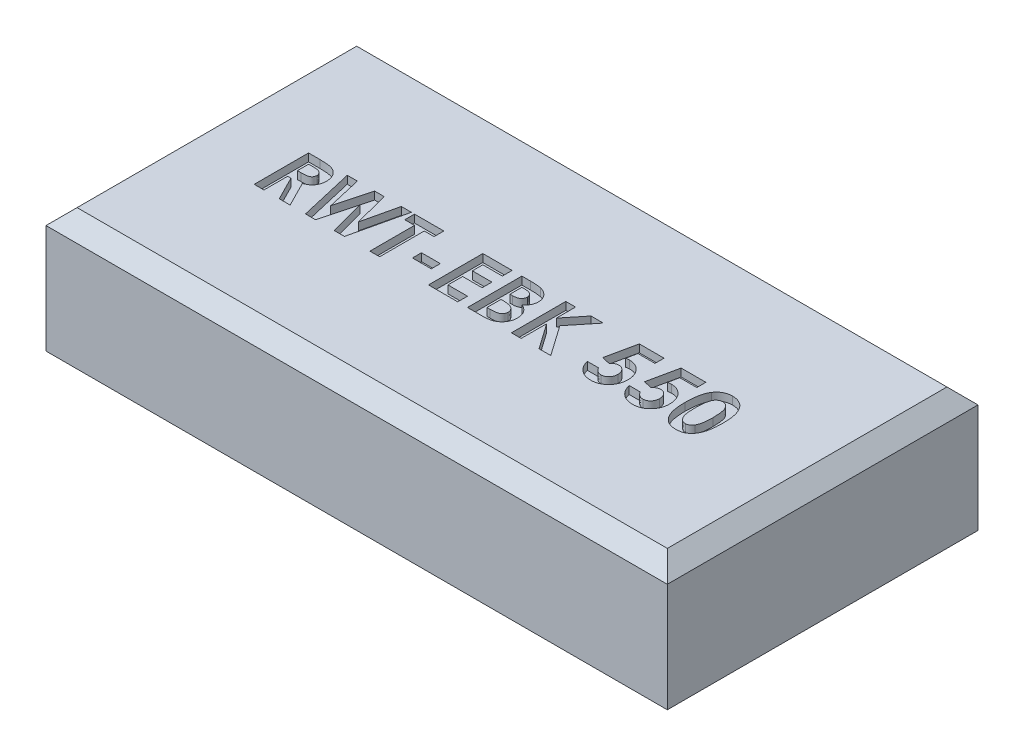
from build123d import *

# Parameters (mm, degrees)
SKETCH1_W           = 40
SKETCH1_H           = 20
BOSS_EXTRUDE1_DEPTH = 8
CHAMFER1_SIZE       = 1
SKETCH4_W           = 1.211538461
SKETCH4_H           = 0.583333333
CUT_EXTRUDE3_DEPTH  = 0.5


with BuildPart() as part:
    # Sketch1 → Boss-Extrude1 (new body)
    with BuildSketch(Plane(origin=(0, 0, 0), x_dir=(1, 0, 0), z_dir=(0, 1, 0))):
        with Locations((0, 2.318501171)):
            Rectangle(SKETCH1_W, SKETCH1_H)
    extrude(amount=BOSS_EXTRUDE1_DEPTH)

    # Chamfer1
    chamfer1_edges = [part.edges().sort_by_distance(p)[0] for p in [
        (0, 8, 7.681498829),
        (-20, 8, -2.318501171),
        (0, 8, -12.318501171),
        (20, 8, -2.318501171),
    ]]
    chamfer(chamfer1_edges, length=CHAMFER1_SIZE)

    # Sketch4 → Cut-Extrude3 (cut)
    # profile 1 of 10: a face of its own
    with BuildSketch(Plane(origin=(0, 8, 0), x_dir=(1, 0, 0), z_dir=(0, 1, 0))):
        with BuildLine():
            Line((-14.596153846, 3.818501171), (-13.864182692, 3.818501171))
            add(Edge.make_bspline(
                [(-13.864182692, 3.818501171), (-13.815799622, 3.818329439), (-13.722745349, 3.81799915), (-13.588566169, 3.81278806), (-13.46530414, 3.805536401), (-13.352776761, 3.794470177), (-13.251032173, 3.779797701), (-13.159968404, 3.76250128), (-13.079588115, 3.742788301), (-13.009213411, 3.718224373), (-12.945703721, 3.690516634), (-12.886503859, 3.658679935), (-12.830307791, 3.623068786), (-12.777491125, 3.582746162), (-12.727594872, 3.538437457), (-12.6805249, 3.49009807), (-12.636946351, 3.437318103), (-12.597129066, 3.380431058), (-12.560838815, 3.320587191), (-12.528765845, 3.257704336), (-12.502684052, 3.191738763), (-12.479637993, 3.123643816), (-12.463038663, 3.052446065), (-12.451494071, 2.978838632), (-12.443041573, 2.902562411), (-12.442555595, 2.850743733), (-12.442307692, 2.824310466)],
                knots=[0, 0, 0, 0, 1.749336639, 3.364467119, 4.854658419, 6.213483162, 7.451590619, 8.570285859, 9.5643256, 10.440900261, 11.26203566, 12.067320669, 12.869050712, 13.665104639, 14.467235401, 15.27997916, 16.102287765, 16.939272006, 17.78853747, 18.631303466, 19.488103222, 20.351255419, 21.228522269, 22.127379805, 23.044756219, 24, 24, 24, 24], degree=3))
            add(Edge.make_bspline(
                [(-12.442307692, 2.824310466), (-12.442951654, 2.796720207), (-12.444214347, 2.742620739), (-12.451015895, 2.663153032), (-12.46344699, 2.587123888), (-12.48227569, 2.514755912), (-12.503916836, 2.4451484), (-12.532694008, 2.379585653), (-12.565171892, 2.317114157), (-12.603744925, 2.258617595), (-12.646076944, 2.20279664), (-12.695308193, 2.151790002), (-12.748249241, 2.102856265), (-12.807876098, 2.059060474), (-12.871560358, 2.017441316), (-12.940567358, 1.979723274), (-13.014446736, 1.944958206), (-13.066387598, 1.925570802), (-13.092948718, 1.91565662)],
                knots=[0, 0, 0, 0, 1.099860209, 2.156625411, 3.176576793, 4.16617041, 5.135385252, 6.078461593, 7.016046972, 7.938469504, 8.868247731, 9.803980173, 10.76021508, 11.73834243, 12.748633912, 13.790971185, 14.870363756, 16, 16, 16, 16], degree=3))
            Line((-13.092948718, 1.91565662), (-12.28525641, 0.318501171))
            Line((-12.28525641, 0.318501171), (-12.983573718, 0.318501171))
            Line((-12.983573718, 0.318501171), (-13.754807692, 1.844142197))
            Line((-13.754807692, 1.844142197), (-13.967948718, 1.844142197))
            Line((-13.967948718, 1.844142197), (-13.967948718, 0.318501171))
            Line((-13.967948718, 0.318501171), (-14.596153846, 0.318501171))
            Line((-14.596153846, 0.318501171), (-14.596153846, 3.818501171))
        make_face()
        with BuildLine():
            Line((-13.967948718, 2.472347325), (-13.723257212, 2.472347325))
            add(Edge.make_bspline(
                [(-13.723257212, 2.472347325), (-13.693341641, 2.472684254), (-13.636059751, 2.473329401), (-13.55368087, 2.476321861), (-13.4788612, 2.483532211), (-13.41127944, 2.492642218), (-13.350595524, 2.503161037), (-13.297350732, 2.518235143), (-13.250724642, 2.534387429), (-13.211269776, 2.554460531), (-13.177560445, 2.577288002), (-13.148454596, 2.603220576), (-13.124379885, 2.633234229), (-13.104565169, 2.666513318), (-13.089151475, 2.70335219), (-13.07790066, 2.743346436), (-13.071613117, 2.786951643), (-13.070889714, 2.817045173), (-13.070512821, 2.832723927)],
                knots=[0, 0, 0, 0, 1.688639943, 3.233382647, 4.650958383, 5.928841754, 7.082724185, 8.122798841, 9.049171256, 9.863274652, 10.613301712, 11.341792392, 12.054588806, 12.776240173, 13.521029143, 14.301969904, 15.115324896, 16, 16, 16, 16], degree=3))
            add(Edge.make_bspline(
                [(-13.070512821, 2.832723927), (-13.071225372, 2.851273039), (-13.072625049, 2.88770933), (-13.086514186, 2.940164814), (-13.108622693, 2.988715953), (-13.1389274, 3.033143381), (-13.177092239, 3.072091531), (-13.220889403, 3.106424636), (-13.27126414, 3.133572687), (-13.317907356, 3.151479252), (-13.36034178, 3.162192934), (-13.398637509, 3.170176676), (-13.442984193, 3.175834983), (-13.493415313, 3.181836624), (-13.549802317, 3.185728385), (-13.612452548, 3.188568594), (-13.681186076, 3.189730664), (-13.729099873, 3.190102157), (-13.754106571, 3.190296043)],
                knots=[0, 0, 0, 0, 1.020303359, 2.004196876, 2.966617323, 3.9489082, 4.950758222, 5.960522915, 7.003732012, 8.091992268, 8.70421221, 9.413913587, 10.24622431, 11.166358409, 12.212345909, 13.359657661, 14.621978493, 16, 16, 16, 16], degree=3))
            Line((-13.754106571, 3.190296043), (-13.967948718, 3.190296043))
            Line((-13.967948718, 3.190296043), (-13.967948718, 2.472347325))
        make_face(mode=Mode.SUBTRACT)
    # profile 2 of 10: a face of its own
    with BuildSketch(Plane(origin=(0, 8, 0), x_dir=(1, 0, 0), z_dir=(0, 1, 0))):
        Polygon((-12.105769231, 3.818501171), (-11.457231571, 3.818501171), (-10.939102564, 1.584026011), (-10.345252404, 3.818501171), (-9.734575321, 3.818501171), (-9.144230769, 1.584026011), (-8.627504006, 3.818501171), (-7.977564103, 3.818501171), (-8.787359776, 0.318501171), (-9.443609776, 0.318501171), (-10.041666667, 2.581021203), (-10.643229167, 0.318501171), (-11.294571314, 0.318501171), align=None)
    # profile 3 of 10: a face of its own
    with BuildSketch(Plane(origin=(0, 8, 0), x_dir=(1, 0, 0), z_dir=(0, 1, 0))):
        Polygon((-7.775641026, 3.818501171), (-5.891025641, 3.818501171), (-5.891025641, 3.190296043), (-6.519230769, 3.190296043), (-6.519230769, 0.318501171), (-7.147435897, 0.318501171), (-7.147435897, 3.190296043), (-7.775641026, 3.190296043), align=None)
    # profile 4 of 10: a face of its own
    with BuildSketch(Plane(origin=(0, 8, 0), x_dir=(1, 0, 0), z_dir=(0, 1, 0))):
        with Locations((-4.791666667, 1.597347325)):
            Rectangle(SKETCH4_W, SKETCH4_H)
    # profile 5 of 10: a face of its own
    with BuildSketch(Plane(origin=(0, 8, 0), x_dir=(1, 0, 0), z_dir=(0, 1, 0))):
        Polygon((-3.378205128, 3.818501171), (-1.493589744, 3.818501171), (-1.493589744, 3.190296043), (-2.75, 3.190296043), (-2.75, 2.51721912), (-1.493589744, 2.51721912), (-1.493589744, 1.889013991), (-2.75, 1.889013991), (-2.75, 0.946706299), (-1.493589744, 0.946706299), (-1.493589744, 0.318501171), (-3.378205128, 0.318501171), align=None)
    # profile 6 of 10: a face of its own
    with BuildSketch(Plane(origin=(0, 8, 0), x_dir=(1, 0, 0), z_dir=(0, 1, 0))):
        with BuildLine():
            Line((-0.865384615, 0.318501171), (-0.865384615, 3.818501171))
            Line((-0.865384615, 3.818501171), (-0.304487179, 3.818501171))
            add(Edge.make_bspline(
                [(-0.304487179, 3.818501171), (-0.265220852, 3.818505652), (-0.189241252, 3.818514323), (-0.079622519, 3.814664873), (0.022039599, 3.809685178), (0.115421572, 3.804114058), (0.200682344, 3.794513904), (0.277692262, 3.784396391), (0.346605192, 3.772195293), (0.389210312, 3.76125053), (0.409254808, 3.756101331)],
                knots=[0, 0, 0, 0, 1.311965854, 2.538629056, 3.664479157, 4.713267157, 5.663616078, 6.530575999, 7.308677837, 8, 8, 8, 8], degree=3))
            add(Edge.make_bspline(
                [(0.409254808, 3.756101331), (0.435575266, 3.748838294), (0.487224455, 3.734585883), (0.561202576, 3.705802524), (0.631381143, 3.673807779), (0.697674471, 3.637307759), (0.759675491, 3.595861807), (0.817148578, 3.549140995), (0.871333285, 3.499020694), (0.920305637, 3.444104065), (0.964568575, 3.386074475), (1.003025131, 3.324947127), (1.03643895, 3.2616567), (1.063178757, 3.195406725), (1.083326699, 3.126502301), (1.09806282, 3.055237661), (1.107613822, 2.981387306), (1.108516267, 2.931144495), (1.108974359, 2.905640594)],
                knots=[0, 0, 0, 0, 1.099996261, 2.158545794, 3.195537121, 4.207578794, 5.205712374, 6.197378256, 7.190519799, 8.17788031, 9.159561366, 10.129234751, 11.085776129, 12.040971148, 13.00380137, 13.975669004, 14.972423361, 16, 16, 16, 16], degree=3))
            add(Edge.make_bspline(
                [(1.108974359, 2.905640594), (1.107776583, 2.872874775), (1.105418909, 2.808379286), (1.090357925, 2.713647082), (1.062116233, 2.624111532), (1.025162666, 2.538122532), (0.974917368, 2.456000819), (0.911115557, 2.377785442), (0.834790614, 2.30106803), (0.776245169, 2.255081117), (0.745793269, 2.231161427)],
                knots=[0, 0, 0, 0, 0.986156485, 1.941127874, 2.875419072, 3.804401753, 4.751181392, 5.761612777, 6.835722519, 8, 8, 8, 8], degree=3))
            add(Edge.make_bspline(
                [(0.745793269, 2.231161427), (0.770470028, 2.218564156), (0.818854324, 2.193864392), (0.887545811, 2.153265354), (0.951146629, 2.110083128), (1.009941945, 2.065186558), (1.062698461, 2.016672412), (1.111594582, 1.967336144), (1.154218027, 1.914350989), (1.192333195, 1.85960544), (1.225462281, 1.802306775), (1.254314061, 1.742551757), (1.278684124, 1.680136252), (1.299321324, 1.615377904), (1.314712554, 1.548053973), (1.324747963, 1.478140383), (1.332431699, 1.405875574), (1.333029422, 1.35665059), (1.333333333, 1.331622165)],
                knots=[0, 0, 0, 0, 1.164658916, 2.283573913, 3.35186032, 4.395461096, 5.390182219, 6.362969632, 7.312859996, 8.245001507, 9.165155236, 10.092416118, 11.032087915, 11.979892451, 12.947605196, 13.931445124, 14.948243989, 16, 16, 16, 16], degree=3))
            add(Edge.make_bspline(
                [(1.333333333, 1.331622165), (1.331361149, 1.283819302), (1.327469051, 1.189480545), (1.29901193, 1.050969584), (1.249676325, 0.91964863), (1.18342878, 0.796039608), (1.101799059, 0.683720797), (1.007948289, 0.585330494), (0.902821331, 0.502045287), (0.805829006, 0.445834233), (0.721938284, 0.40811136), (0.652453165, 0.384788701), (0.577827621, 0.363182624), (0.49669469, 0.348010391), (0.410525202, 0.334123096), (0.318478999, 0.325548791), (0.220728113, 0.319738197), (0.153588579, 0.318921849), (0.118990385, 0.318501171)],
                knots=[0, 0, 0, 0, 1.284142165, 2.534249414, 3.780121997, 5.041676246, 6.291546858, 7.49970053, 8.684500223, 9.883330709, 10.50184324, 11.153274765, 11.851151195, 12.587658647, 13.369265475, 14.195992086, 15.070362669, 16, 16, 16, 16], degree=3))
            Line((0.118990385, 0.318501171), (-0.865384615, 0.318501171))
        make_face()
        with BuildLine():
            Line((-0.237179487, 3.190296043), (-0.237179487, 2.42747553))
            Line((-0.237179487, 2.42747553), (-0.0703125, 2.42747553))
            add(Edge.make_bspline(
                [(-0.0703125, 2.42747553), (-0.047633777, 2.427673297), (-0.003853875, 2.428055074), (0.059381549, 2.432972233), (0.118180282, 2.441361212), (0.172319311, 2.453065948), (0.222302963, 2.467929257), (0.267811927, 2.485813017), (0.308646108, 2.507633149), (0.356085982, 2.540135198), (0.406233349, 2.587963419), (0.450377513, 2.657061193), (0.476378131, 2.736523371), (0.479273899, 2.792566252), (0.480769231, 2.821505979)],
                knots=[0, 0, 0, 0, 1.065314748, 2.056525647, 2.977365736, 3.853934255, 4.656397591, 5.425096493, 6.14721249, 6.826394842, 8.123232004, 9.372140726, 10.643011755, 12, 12, 12, 12], degree=3))
            add(Edge.make_bspline(
                [(0.480769231, 2.821505979), (0.479572691, 2.848612841), (0.47725923, 2.901022871), (0.451079951, 2.97461122), (0.410418355, 3.039825558), (0.362411626, 3.084459439), (0.317203962, 3.114943064), (0.278494386, 3.135015233), (0.236007719, 3.152983634), (0.188921466, 3.166722711), (0.137504514, 3.17703203), (0.082006625, 3.184602991), (0.022332045, 3.189756109), (-0.018885315, 3.190112204), (-0.040164263, 3.190296043)],
                knots=[0, 0, 0, 0, 1.347982417, 2.606269829, 3.849316587, 5.153353503, 5.842674298, 6.568177932, 7.326619318, 8.142485038, 9.012069166, 9.942760135, 10.937925643, 12, 12, 12, 12], degree=3))
            Line((-0.040164263, 3.190296043), (-0.237179487, 3.190296043))
        make_face(mode=Mode.SUBTRACT)
        with BuildLine():
            Line((-0.237179487, 1.844142197), (-0.237179487, 0.946706299))
            Line((-0.237179487, 0.946706299), (-0.056290064, 0.946706299))
            add(Edge.make_bspline(
                [(-0.056290064, 0.946706299), (-0.020527995, 0.946910607), (0.048229046, 0.947303413), (0.146723385, 0.952049449), (0.236279363, 0.960603342), (0.316659689, 0.971282188), (0.387987483, 0.985750355), (0.450021639, 1.004144774), (0.503612874, 1.02438184), (0.548439854, 1.049377018), (0.585060929, 1.078465208), (0.618107609, 1.108194036), (0.645051813, 1.142489048), (0.666370569, 1.179878054), (0.684821916, 1.219432285), (0.695950465, 1.262696318), (0.704423352, 1.308387911), (0.704889637, 1.339991798), (0.705128205, 1.356161427)],
                knots=[0, 0, 0, 0, 1.753078804, 3.370512758, 4.83203934, 6.162291463, 7.344201807, 8.395507345, 9.331626367, 10.147333109, 10.898971645, 11.62040215, 12.321813352, 13.025280112, 13.727906689, 14.453419512, 15.208716525, 16, 16, 16, 16], degree=3))
            add(Edge.make_bspline(
                [(0.705128205, 1.356161427), (0.704602095, 1.374651653), (0.703577374, 1.410665639), (0.695208464, 1.463303922), (0.67999942, 1.512445252), (0.660842888, 1.559346239), (0.634185556, 1.602327663), (0.602504228, 1.642876951), (0.564225095, 1.679620976), (0.521177978, 1.714782156), (0.470967777, 1.745567673), (0.413570936, 1.772279563), (0.348675643, 1.79458835), (0.27608088, 1.81235062), (0.196104895, 1.827425213), (0.108163951, 1.83642641), (0.012990452, 1.843120995), (-0.053004401, 1.843794061), (-0.087139423, 1.844142197)],
                knots=[0, 0, 0, 0, 0.845221588, 1.646264278, 2.427170338, 3.19324141, 3.95557735, 4.731569926, 5.540061037, 6.376114724, 7.268642756, 8.224665384, 9.265483498, 10.400594375, 11.639216012, 12.983232105, 14.439614077, 16, 16, 16, 16], degree=3))
            Line((-0.087139423, 1.844142197), (-0.237179487, 1.844142197))
        make_face(mode=Mode.SUBTRACT)
    # profile 7 of 10: a face of its own
    with BuildSketch(Plane(origin=(0, 8, 0), x_dir=(1, 0, 0), z_dir=(0, 1, 0))):
        Polygon((1.961538462, 3.818501171), (2.58974359, 3.818501171), (2.58974359, 2.586630177), (3.582532051, 3.818501171), (4.375500801, 3.818501171), (3.128205128, 2.270424248), (4.496794872, 0.318501171), (3.740284455, 0.318501171), (2.58974359, 1.959827293), (2.58974359, 0.318501171), (1.961538462, 0.318501171), align=None)
    # profile 8 of 10: a face of its own
    with BuildSketch(Plane(origin=(0, 8, 0), x_dir=(1, 0, 0), z_dir=(0, 1, 0))):
        with BuildLine():
            Line((6.694811699, 3.818501171), (8.288461538, 3.818501171))
            Line((8.288461538, 3.818501171), (8.288461538, 3.235167838))
            Line((8.288461538, 3.235167838), (7.192608173, 3.235167838))
            Line((7.192608173, 3.235167838), (7.055889423, 2.573308863))
            add(Edge.make_bspline(
                [(7.055889423, 2.573308863), (7.07451931, 2.578497522), (7.111261274, 2.588730623), (7.166613089, 2.598993128), (7.220256712, 2.605644958), (7.255457329, 2.606532224), (7.272536058, 2.606962709)],
                knots=[0, 0, 0, 0, 1.05461699, 2.079921384, 3.068411212, 4, 4, 4, 4], degree=3))
            add(Edge.make_bspline(
                [(7.272536058, 2.606962709), (7.309752396, 2.606109919), (7.383113996, 2.60442888), (7.490432708, 2.588470341), (7.593196714, 2.563336125), (7.691091546, 2.527489548), (7.784021573, 2.480834303), (7.872099445, 2.424394534), (7.955433262, 2.358071113), (8.032542665, 2.281822516), (8.103394006, 2.19809983), (8.164995206, 2.107544887), (8.217606474, 2.011448911), (8.259451659, 1.909214572), (8.292479446, 1.801483971), (8.316346062, 1.688188071), (8.330459584, 1.569192598), (8.332362706, 1.488010495), (8.333333333, 1.446606139)],
                knots=[0, 0, 0, 0, 1.01440847, 1.999622559, 2.951875003, 3.895578053, 4.836219714, 5.782137149, 6.743708247, 7.735272588, 8.734977101, 9.730283169, 10.717124674, 11.717316708, 12.737475749, 13.78628267, 14.87096371, 16, 16, 16, 16], degree=3))
            add(Edge.make_bspline(
                [(8.333333333, 1.446606139), (8.332147212, 1.404731748), (8.329806647, 1.322101333), (8.314536605, 1.200605395), (8.287584707, 1.084239715), (8.250563578, 0.972692784), (8.201790611, 0.866784445), (8.143134442, 0.765417568), (8.073603355, 0.669344566), (7.993879688, 0.579550304), (7.907209604, 0.497476624), (7.814926423, 0.425276252), (7.717678463, 0.364520223), (7.615463378, 0.31541908), (7.508867607, 0.276571129), (7.397858799, 0.248291676), (7.281897463, 0.232074981), (7.203174783, 0.229875532), (7.163161058, 0.228757581)],
                knots=[0, 0, 0, 0, 1.06808661, 2.107647099, 3.116961351, 4.110378221, 5.100014249, 6.085620622, 7.093190682, 8.119403071, 9.144090782, 10.133780668, 11.103064255, 12.062861538, 13.020824475, 13.992378307, 14.979551724, 16, 16, 16, 16], degree=3))
            add(Edge.make_bspline(
                [(7.163161058, 0.228757581), (7.127377974, 0.229672135), (7.056806245, 0.231475826), (6.952857186, 0.242562264), (6.85263875, 0.262163189), (6.756682988, 0.290530803), (6.663980283, 0.32544486), (6.575602306, 0.369111487), (6.491063405, 0.420699211), (6.410603638, 0.479266557), (6.335530363, 0.545240399), (6.267011432, 0.617460138), (6.204632023, 0.695015476), (6.149726958, 0.778863212), (6.102468347, 0.868879466), (6.060558448, 0.964003375), (6.026254775, 1.065228337), (6.008846649, 1.135403104), (6, 1.171065274)],
                knots=[0, 0, 0, 0, 1.054957082, 2.080596141, 3.077793124, 4.061112343, 5.027190972, 5.994718051, 6.962465889, 7.943658696, 8.924948258, 9.904494768, 10.875059, 11.855380583, 12.854004648, 13.869083016, 14.917087635, 16, 16, 16, 16], degree=3))
            Line((6, 1.171065274), (6.717948718, 1.171065274))
            add(Edge.make_bspline(
                [(6.717948718, 1.171065274), (6.731072838, 1.146352842), (6.756578067, 1.098327052), (6.805094652, 1.034565599), (6.859405888, 0.980192572), (6.91902186, 0.934676733), (6.98432884, 0.900577041), (7.052665694, 0.874717413), (7.124890908, 0.859774091), (7.174079467, 0.857906028), (7.198918269, 0.856962709)],
                knots=[0, 0, 0, 0, 1.104910296, 2.147267069, 3.153527244, 4.136738762, 5.099945312, 6.05603338, 7.018353, 8, 8, 8, 8], degree=3))
            add(Edge.make_bspline(
                [(7.198918269, 0.856962709), (7.216230581, 0.857614079), (7.250292846, 0.858895659), (7.300478207, 0.86567554), (7.348382339, 0.87851648), (7.394361398, 0.896298197), (7.438538895, 0.918474006), (7.48028153, 0.946469521), (7.520315551, 0.978693396), (7.558031476, 1.015670402), (7.592191233, 1.056891163), (7.622145603, 1.10118568), (7.648928941, 1.14756972), (7.668767769, 1.197880672), (7.685014092, 1.250616232), (7.696978541, 1.306174201), (7.704128648, 1.364619465), (7.704790557, 1.404518409), (7.705128205, 1.424871363)],
                knots=[0, 0, 0, 0, 0.978869489, 1.925942215, 2.855067702, 3.774946051, 4.70828698, 5.642468714, 6.60995405, 7.609372294, 8.622401667, 9.629904756, 10.629323, 11.642352373, 12.678539694, 13.745912462, 14.850161547, 16, 16, 16, 16], degree=3))
            add(Edge.make_bspline(
                [(7.705128205, 1.424871363), (7.704736326, 1.444751879), (7.703973523, 1.483449786), (7.697663464, 1.540272174), (7.68637489, 1.594186337), (7.670994112, 1.645605217), (7.651304879, 1.694216573), (7.627243321, 1.740309765), (7.598706643, 1.783651807), (7.565541639, 1.823360298), (7.530174819, 1.859782055), (7.492179491, 1.891636234), (7.451897972, 1.918072991), (7.410581959, 1.941153049), (7.366582268, 1.957950212), (7.320888274, 1.969517798), (7.27354803, 1.978005628), (7.241258277, 1.978504319), (7.224859776, 1.978757581)],
                knots=[0, 0, 0, 0, 1.166249705, 2.270133367, 3.348514167, 4.393962215, 5.415026464, 6.420877785, 7.440098956, 8.453121383, 9.451844239, 10.415694839, 11.355045125, 12.27538808, 13.187007209, 14.108269027, 15.039275622, 16, 16, 16, 16], degree=3))
            add(Edge.make_bspline(
                [(7.224859776, 1.978757581), (7.207047192, 1.978081693), (7.171346953, 1.976727067), (7.118305333, 1.965704839), (7.065903247, 1.94786674), (7.013849287, 1.923256255), (6.962660177, 1.891048895), (6.910985012, 1.853273355), (6.860553471, 1.807184883), (6.828487694, 1.772858084), (6.811899038, 1.755099729)],
                knots=[0, 0, 0, 0, 0.88288272, 1.769486374, 2.674910571, 3.623812639, 4.617874466, 5.670434592, 6.794841017, 8, 8, 8, 8], degree=3))
            Line((6.811899038, 1.755099729), (6.283253205, 1.876393799))
            Line((6.283253205, 1.876393799), (6.694811699, 3.818501171))
        make_face()
    # profile 9 of 10: a face of its own
    with BuildSketch(Plane(origin=(0, 8, 0), x_dir=(1, 0, 0), z_dir=(0, 1, 0))):
        with BuildLine():
            Line((9.387119391, 3.818501171), (10.980769231, 3.818501171))
            Line((10.980769231, 3.818501171), (10.980769231, 3.235167838))
            Line((10.980769231, 3.235167838), (9.884915865, 3.235167838))
            Line((9.884915865, 3.235167838), (9.748197115, 2.573308863))
            add(Edge.make_bspline(
                [(9.748197115, 2.573308863), (9.766827002, 2.578497522), (9.803568967, 2.588730623), (9.858920782, 2.598993128), (9.912564404, 2.605644958), (9.947765022, 2.606532224), (9.96484375, 2.606962709)],
                knots=[0, 0, 0, 0, 1.05461699, 2.079921384, 3.068411212, 4, 4, 4, 4], degree=3))
            add(Edge.make_bspline(
                [(9.96484375, 2.606962709), (10.002060088, 2.606109919), (10.075421688, 2.60442888), (10.1827404, 2.588470341), (10.285504407, 2.563336125), (10.383399238, 2.527489548), (10.476329265, 2.480834303), (10.564407137, 2.424394534), (10.647740954, 2.358071113), (10.724850358, 2.281822516), (10.795701698, 2.19809983), (10.857302898, 2.107544887), (10.909914167, 2.011448911), (10.951759351, 1.909214572), (10.984787138, 1.801483971), (11.008653754, 1.688188071), (11.022767277, 1.569192598), (11.024670399, 1.488010495), (11.025641026, 1.446606139)],
                knots=[0, 0, 0, 0, 1.01440847, 1.999622559, 2.951875003, 3.895578053, 4.836219714, 5.782137149, 6.743708247, 7.735272588, 8.734977101, 9.730283169, 10.717124674, 11.717316708, 12.737475749, 13.78628267, 14.87096371, 16, 16, 16, 16], degree=3))
            add(Edge.make_bspline(
                [(11.025641026, 1.446606139), (11.024454904, 1.404731748), (11.022114339, 1.322101333), (11.006844297, 1.200605395), (10.979892399, 1.084239715), (10.94287127, 0.972692784), (10.894098303, 0.866784445), (10.835442135, 0.765417568), (10.765911048, 0.669344566), (10.68618738, 0.579550304), (10.599517296, 0.497476624), (10.507234115, 0.425276252), (10.409986156, 0.364520223), (10.30777107, 0.31541908), (10.2011753, 0.276571129), (10.090166491, 0.248291676), (9.974205155, 0.232074981), (9.895482475, 0.229875532), (9.85546875, 0.228757581)],
                knots=[0, 0, 0, 0, 1.06808661, 2.107647099, 3.116961351, 4.110378221, 5.100014249, 6.085620622, 7.093190682, 8.119403071, 9.144090782, 10.133780668, 11.103064255, 12.062861538, 13.020824475, 13.992378307, 14.979551724, 16, 16, 16, 16], degree=3))
            add(Edge.make_bspline(
                [(9.85546875, 0.228757581), (9.819685666, 0.229672135), (9.749113937, 0.231475826), (9.645164879, 0.242562264), (9.544946443, 0.262163189), (9.44899068, 0.290530803), (9.356287975, 0.32544486), (9.267909998, 0.369111487), (9.183371097, 0.420699211), (9.102911331, 0.479266557), (9.027838055, 0.545240399), (8.959319124, 0.617460138), (8.896939715, 0.695015476), (8.84203465, 0.778863212), (8.79477604, 0.868879466), (8.75286614, 0.964003375), (8.718562467, 1.065228337), (8.701154341, 1.135403104), (8.692307692, 1.171065274)],
                knots=[0, 0, 0, 0, 1.054957082, 2.080596141, 3.077793124, 4.061112343, 5.027190972, 5.994718051, 6.962465889, 7.943658696, 8.924948258, 9.904494768, 10.875059, 11.855380583, 12.854004648, 13.869083016, 14.917087635, 16, 16, 16, 16], degree=3))
            Line((8.692307692, 1.171065274), (9.41025641, 1.171065274))
            add(Edge.make_bspline(
                [(9.41025641, 1.171065274), (9.42338053, 1.146352842), (9.448885759, 1.098327052), (9.497402344, 1.034565599), (9.551713581, 0.980192572), (9.611329552, 0.934676733), (9.676636533, 0.900577041), (9.744973386, 0.874717413), (9.8171986, 0.859774091), (9.86638716, 0.857906028), (9.891225962, 0.856962709)],
                knots=[0, 0, 0, 0, 1.104910296, 2.147267069, 3.153527244, 4.136738762, 5.099945312, 6.05603338, 7.018353, 8, 8, 8, 8], degree=3))
            add(Edge.make_bspline(
                [(9.891225962, 0.856962709), (9.908538273, 0.857614079), (9.942600538, 0.858895659), (9.9927859, 0.86567554), (10.040690032, 0.87851648), (10.086669091, 0.896298197), (10.130846587, 0.918474006), (10.172589223, 0.946469521), (10.212623243, 0.978693396), (10.250339168, 1.015670402), (10.284498925, 1.056891163), (10.314453296, 1.10118568), (10.341236634, 1.14756972), (10.361075462, 1.197880672), (10.377321784, 1.250616232), (10.389286233, 1.306174201), (10.396436341, 1.364619465), (10.397098249, 1.404518409), (10.397435897, 1.424871363)],
                knots=[0, 0, 0, 0, 0.978869489, 1.925942215, 2.855067702, 3.774946051, 4.70828698, 5.642468714, 6.60995405, 7.609372294, 8.622401667, 9.629904756, 10.629323, 11.642352373, 12.678539694, 13.745912462, 14.850161547, 16, 16, 16, 16], degree=3))
            add(Edge.make_bspline(
                [(10.397435897, 1.424871363), (10.397044018, 1.444751879), (10.396281215, 1.483449786), (10.389971156, 1.540272174), (10.378682582, 1.594186337), (10.363301804, 1.645605217), (10.343612571, 1.694216573), (10.319551013, 1.740309765), (10.291014335, 1.783651807), (10.257849331, 1.823360298), (10.222482512, 1.859782055), (10.184487184, 1.891636234), (10.144205664, 1.918072991), (10.102889652, 1.941153049), (10.05888996, 1.957950212), (10.013195966, 1.969517798), (9.965855722, 1.978005628), (9.933565969, 1.978504319), (9.917167468, 1.978757581)],
                knots=[0, 0, 0, 0, 1.166249705, 2.270133367, 3.348514167, 4.393962215, 5.415026464, 6.420877785, 7.440098956, 8.453121383, 9.451844239, 10.415694839, 11.355045125, 12.27538808, 13.187007209, 14.108269027, 15.039275622, 16, 16, 16, 16], degree=3))
            add(Edge.make_bspline(
                [(9.917167468, 1.978757581), (9.899354884, 1.978081693), (9.863654645, 1.976727067), (9.810613025, 1.965704839), (9.75821094, 1.94786674), (9.706156979, 1.923256255), (9.654967869, 1.891048895), (9.603292704, 1.853273355), (9.552861163, 1.807184883), (9.520795387, 1.772858084), (9.504206731, 1.755099729)],
                knots=[0, 0, 0, 0, 0.88288272, 1.769486374, 2.674910571, 3.623812639, 4.617874466, 5.670434592, 6.794841017, 8, 8, 8, 8], degree=3))
            Line((9.504206731, 1.755099729), (8.975560897, 1.876393799))
            Line((8.975560897, 1.876393799), (9.387119391, 3.818501171))
        make_face()
    # profile 10 of 10: a face of its own
    with BuildSketch(Plane(origin=(0, 8, 0), x_dir=(1, 0, 0), z_dir=(0, 1, 0))):
        with BuildLine():
            add(Edge.make_bspline(
                [(12.608072917, 3.908244761), (12.638480652, 3.907793349), (12.698270385, 3.906905754), (12.786329406, 3.897292372), (12.871154591, 3.882769234), (12.953077785, 3.86251452), (13.031509297, 3.835708128), (13.107019968, 3.803621336), (13.178711003, 3.764571127), (13.247496691, 3.720461909), (13.313350535, 3.670524021), (13.374689786, 3.613592251), (13.432634627, 3.550976601), (13.485930767, 3.481730434), (13.535758465, 3.406483618), (13.581953994, 3.325224221), (13.624163718, 3.237554532), (13.662860706, 3.143316345), (13.697463675, 3.04109707), (13.726609713, 2.929724208), (13.751607317, 2.809172324), (13.772707059, 2.679141347), (13.788655053, 2.539458435), (13.799404323, 2.390216385), (13.80678098, 2.231702915), (13.807383012, 2.122963977), (13.807692308, 2.067098927)],
                knots=[0, 0, 0, 0, 0.879237366, 1.728815576, 2.559023295, 3.367336655, 4.166867292, 4.954216142, 5.737608147, 6.525189134, 7.316157332, 8.124696809, 8.942788509, 9.781158001, 10.649253743, 11.551476218, 12.482711956, 13.461909668, 14.496590415, 15.601789533, 16.789733467, 18.056700938, 19.410929216, 20.8549011, 22.384193279, 24, 24, 24, 24], degree=3))
            add(Edge.make_bspline(
                [(13.807692308, 2.067098927), (13.807358042, 2.010534943), (13.806708571, 1.900632136), (13.799710973, 1.740668821), (13.787660778, 1.590343185), (13.772129618, 1.449670779), (13.750856176, 1.31872589), (13.725942019, 1.19716946), (13.69633592, 1.085045549), (13.660593141, 0.982606796), (13.622130387, 0.888203106), (13.579805201, 0.800704352), (13.534355307, 0.71987354), (13.486823186, 0.644491226), (13.434602955, 0.576779642), (13.380236318, 0.514436242), (13.321356056, 0.459835764), (13.260441254, 0.410164346), (13.195260358, 0.367238273), (13.12648556, 0.329695837), (13.052890726, 0.299244462), (12.975817364, 0.272759483), (12.893951743, 0.253746125), (12.808594697, 0.238659651), (12.718782561, 0.23032194), (12.657634842, 0.229287592), (12.626302083, 0.228757581)],
                knots=[0, 0, 0, 0, 1.643780988, 3.193836972, 4.651895693, 6.025988579, 7.305620092, 8.505800249, 9.631074763, 10.672816429, 11.65661981, 12.592235626, 13.49536222, 14.350718032, 15.179365177, 15.97804903, 16.751647189, 17.51006938, 18.259804725, 19.016521909, 19.783502495, 20.571750527, 21.382245291, 22.22305063, 23.089471752, 24, 24, 24, 24], degree=3))
            add(Edge.make_bspline(
                [(12.626302083, 0.228757581), (12.59497017, 0.229297816), (12.533591414, 0.230356128), (12.443536417, 0.238597657), (12.357727022, 0.253807241), (12.275213712, 0.272905453), (12.196570768, 0.299185861), (12.1214211, 0.330548319), (12.050342543, 0.367856509), (11.983138292, 0.410882596), (11.920037802, 0.460221675), (11.86006049, 0.515346009), (11.803339031, 0.576115872), (11.750736299, 0.643211936), (11.701390812, 0.71573861), (11.655817167, 0.794524112), (11.614042751, 0.879453732), (11.574760854, 0.970645855), (11.540629858, 1.070063741), (11.510254856, 1.17859518), (11.485372454, 1.297144871), (11.46536036, 1.425674728), (11.449382717, 1.563912456), (11.437497186, 1.711924777), (11.43046072, 1.869780633), (11.429818059, 1.978282826), (11.429487179, 2.034146203)],
                knots=[0, 0, 0, 0, 0.917216111, 1.796812873, 2.643793957, 3.46689424, 4.273913431, 5.068098542, 5.848489301, 6.620921603, 7.401012384, 8.190319798, 9.003608147, 9.831726257, 10.68377682, 11.569763213, 12.493818149, 13.453288342, 14.474581811, 15.568529029, 16.750744269, 18.018426408, 19.375425659, 20.823733699, 22.36466933, 24, 24, 24, 24], degree=3))
            add(Edge.make_bspline(
                [(11.429487179, 2.034146203), (11.430086537, 2.111763968), (11.431243006, 2.261528446), (11.445898626, 2.477894573), (11.46740936, 2.677887577), (11.499003532, 2.861172919), (11.538069289, 3.028429436), (11.588095025, 3.178555327), (11.645045686, 3.313627923), (11.693574966, 3.393645742), (11.716947115, 3.432183062)],
                knots=[0, 0, 0, 0, 1.288568992, 2.486310467, 3.599230591, 4.627010532, 5.572937695, 6.447898582, 7.252493626, 8, 8, 8, 8], degree=3))
            add(Edge.make_bspline(
                [(11.716947115, 3.432183062), (11.744123137, 3.470042113), (11.797257615, 3.544064019), (11.890164735, 3.641240945), (11.989981339, 3.72435141), (12.098757603, 3.791514551), (12.214773185, 3.844479409), (12.339024139, 3.881887892), (12.471051626, 3.903683818), (12.561717103, 3.906701743), (12.608072917, 3.908244761)],
                knots=[0, 0, 0, 0, 1.058512271, 2.069600068, 3.047294572, 4.004278952, 4.967380941, 5.939006123, 6.946246673, 8, 8, 8, 8], degree=3))
        make_face()
        with BuildLine():
            add(Edge.make_bspline(
                [(12.623497596, 3.280039632), (12.596008751, 3.278736716), (12.542116023, 3.276182308), (12.463915106, 3.254498986), (12.390176524, 3.221007927), (12.334085555, 3.180706674), (12.292102022, 3.142073089), (12.262767826, 3.107110952), (12.234479618, 3.068095726), (12.209494048, 3.023266856), (12.185901148, 2.974235095), (12.162843773, 2.920777869), (12.14394278, 2.861582152), (12.125373055, 2.797656056), (12.109104244, 2.727232193), (12.095474546, 2.649734927), (12.08329761, 2.564660285), (12.074804052, 2.471952543), (12.066885506, 2.371708697), (12.061209118, 2.263705442), (12.058835962, 2.147971914), (12.058081608, 2.068267952), (12.057692308, 2.027134985)],
                knots=[0, 0, 0, 0, 1.076674018, 2.110852608, 3.161083442, 4.239746716, 4.804137807, 5.395870207, 6.026861976, 6.692161227, 7.405688833, 8.16177676, 8.973626916, 9.841385931, 10.773283133, 11.807421078, 12.927755683, 14.143907515, 15.458935494, 16.872852025, 18.386167141, 20, 20, 20, 20], degree=3))
            add(Edge.make_bspline(
                [(12.057692308, 2.027134985), (12.05833305, 1.973845238), (12.05956172, 1.871658197), (12.065996919, 1.724709674), (12.078895741, 1.590974686), (12.094939272, 1.46954686), (12.117473067, 1.361213689), (12.143399656, 1.264950241), (12.175416688, 1.181983641), (12.212418538, 1.111114005), (12.253399754, 1.050825352), (12.297886667, 0.999579726), (12.344364656, 0.955203432), (12.394284452, 0.919157115), (12.44752696, 0.891532879), (12.503647703, 0.871663107), (12.562682345, 0.859499993), (12.603108659, 0.85781336), (12.623497596, 0.856962709)],
                knots=[0, 0, 0, 0, 1.771748488, 3.397459088, 4.888034009, 6.237357457, 7.467047327, 8.564189669, 9.548206622, 10.417051504, 11.216568818, 11.965764335, 12.669334354, 13.348544111, 14.005342236, 14.656555988, 15.322436492, 16, 16, 16, 16], degree=3))
            add(Edge.make_bspline(
                [(12.623497596, 0.856962709), (12.64318685, 0.857544788), (12.681735959, 0.858684424), (12.737949195, 0.87038264), (12.791108425, 0.889401398), (12.841053145, 0.916304766), (12.887962, 0.950516515), (12.931605729, 0.992186986), (12.971655179, 1.041731537), (12.994988171, 1.07850092), (13.007011218, 1.097447485)],
                knots=[0, 0, 0, 0, 0.992283464, 1.942767638, 2.88273346, 3.832339453, 4.79467288, 5.803907806, 6.868395428, 8, 8, 8, 8], degree=3))
            add(Edge.make_bspline(
                [(13.007011218, 1.097447485), (13.021166331, 1.12333736), (13.050848455, 1.177626329), (13.085196661, 1.269236938), (13.114109066, 1.372558565), (13.13899355, 1.487912756), (13.156013019, 1.615754481), (13.170670165, 1.755273086), (13.177739671, 1.907171129), (13.178889565, 2.012406641), (13.179487179, 2.067098927)],
                knots=[0, 0, 0, 0, 0.710965849, 1.490837728, 2.352621235, 3.297892224, 4.334225155, 5.461620853, 6.680770821, 8, 8, 8, 8], degree=3))
            add(Edge.make_bspline(
                [(13.179487179, 2.067098927), (13.179256334, 2.122265969), (13.178811995, 2.228453106), (13.170659668, 2.380897234), (13.15930693, 2.520129644), (13.142701151, 2.645839487), (13.121334799, 2.758331932), (13.095000689, 2.857599625), (13.063954732, 2.943838204), (13.027137927, 3.016961676), (12.986361029, 3.079106596), (12.943075106, 3.132422118), (12.897097128, 3.177941565), (12.848503986, 3.215836235), (12.796170975, 3.244790606), (12.741097722, 3.265234787), (12.683171324, 3.27760283), (12.64365732, 3.279216402), (12.623497596, 3.280039632)],
                knots=[0, 0, 0, 0, 1.793836731, 3.452829483, 4.963243077, 6.335886805, 7.574563692, 8.684454726, 9.672768357, 10.54971625, 11.340229787, 12.085688095, 12.778991901, 13.440269426, 14.083255152, 14.715733572, 15.344777694, 16, 16, 16, 16], degree=3))
        make_face(mode=Mode.SUBTRACT)
    extrude(amount=-CUT_EXTRUDE3_DEPTH, mode=Mode.SUBTRACT)


solid = part.part
